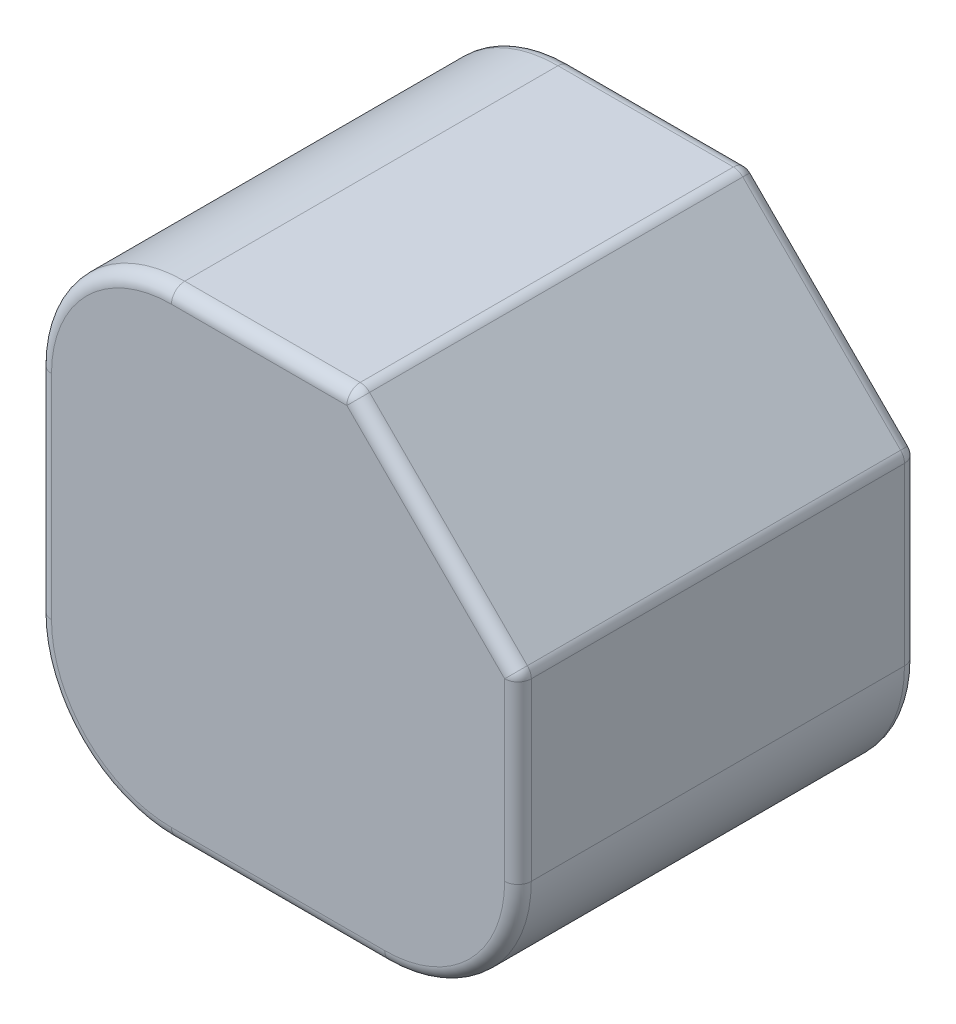
from build123d import *

# Parameters (mm, degrees)
SKETCH1_W                 = 36
SKETCH1_H                 = 36
BOSS_EXTRUDE1_DEPTH       = 15
SKETCH2_R                 = 10
CUT_EXTRUDE1_DEPTH        = 4
SKETCH4_R                 = 10
CUT_EXTRUDE2_DEPTH        = 4
M8X1_0_TAPPED_HOLE1_D     = 7
M8X1_0_TAPPED_HOLE1_DEPTH = 15
M8X1_0_TAPPED_HOLE1_TIP   = 2.103012167
M8X1_0_TAPPED_HOLE2_D     = 7
M8X1_0_TAPPED_HOLE2_DEPTH = 15
M8X1_0_TAPPED_HOLE2_TIP   = 2.103012167
FILLET1_R                 = 10
M4X0_7_TAPPED_HOLE1_D     = 3.3
M4X0_7_TAPPED_HOLE1_DEPTH = 10.1
M4X0_7_TAPPED_HOLE1_TIP   = 0.991420021
CUT_EXTRUDE3_DEPTH        = 60.093146983
FILLET2_R                 = 1


with BuildPart() as part:
    # Sketch1 → Boss-Extrude1 (new, symmetric)
    with BuildSketch(Plane.XY):
        with Locations((-18, -18)):
            Rectangle(SKETCH1_W, SKETCH1_H)
    extrude(amount=BOSS_EXTRUDE1_DEPTH, both=True)

    # Sketch2 → Cut-Extrude1 (cut)
    with BuildSketch(Plane.XZ.offset(36)):
        with Locations((-19.294, 0)):
            Circle(SKETCH2_R)
    extrude(amount=-CUT_EXTRUDE1_DEPTH, mode=Mode.SUBTRACT)

    # Sketch4 → Cut-Extrude2 (cut)
    with BuildSketch(Plane.ZY.offset(36)):
        with Locations(Location((0, -19.294, 0), (0, 0, 270))):
            Circle(SKETCH4_R)
    extrude(amount=-CUT_EXTRUDE2_DEPTH, mode=Mode.SUBTRACT)

    # M8x1.0 Tapped Hole1
    with Locations(Plane.ZY.offset(32)):
        with Locations((0, -19.294)):
            Hole(M8X1_0_TAPPED_HOLE1_D / 2, depth=M8X1_0_TAPPED_HOLE1_DEPTH)
            with Locations((0, 0, -(M8X1_0_TAPPED_HOLE1_DEPTH + M8X1_0_TAPPED_HOLE1_TIP / 2))):  # 118° drill point
                Cone(0, M8X1_0_TAPPED_HOLE1_D / 2, M8X1_0_TAPPED_HOLE1_TIP, mode=Mode.SUBTRACT)

    # M8x1.0 Tapped Hole2
    with Locations(Plane.XZ.offset(32)):
        with Locations((-19.294, 0)):
            Hole(M8X1_0_TAPPED_HOLE2_D / 2, depth=M8X1_0_TAPPED_HOLE2_DEPTH)
            with Locations((0, 0, -(M8X1_0_TAPPED_HOLE2_DEPTH + M8X1_0_TAPPED_HOLE2_TIP / 2))):  # 118° drill point
                Cone(0, M8X1_0_TAPPED_HOLE2_D / 2, M8X1_0_TAPPED_HOLE2_TIP, mode=Mode.SUBTRACT)

    # Fillet1
    # the kernel refuses this fillet: 10 mm, written as the material it takes off along each edge
    with BuildSketch(Plane(origin=(0, -36, 40), x_dir=(0, 1, 0), z_dir=(0, 0, -1)), Plane(origin=(-36, 0, -40), x_dir=(1, 0, 0), z_dir=(0, 0, 1))) as fillet1_piece_1:
        with BuildLine():
            CenterArc((FILLET1_R, -FILLET1_R), FILLET1_R, 90, 90)
            Line((0, -FILLET1_R), (0, 0))
            Line((0, 0), (FILLET1_R, 0))
        make_face()
    extrude(amount=80, mode=Mode.SUBTRACT)
    with BuildSketch(Plane(origin=(-36, -36, -40), x_dir=(1, 0, 0), z_dir=(0, 0, 1))) as fillet1_piece_2:
        with BuildLine():
            CenterArc((FILLET1_R, FILLET1_R), FILLET1_R, 180, 90)
            Line((0, FILLET1_R), (0, 0))
            Line((0, 0), (FILLET1_R, 0))
        make_face()
    extrude(amount=80, mode=Mode.SUBTRACT)

    # M4x0.7 Tapped Hole1
    with Locations(Plane(origin=(0, 0, -15), x_dir=(-1, 0, 0), z_dir=(0, 0, -1))):
        with Locations((29.900601718, -29.900601718), (4.805112606, -23.176285677), (23.176285677, -4.805112606)):
            Hole(M4X0_7_TAPPED_HOLE1_D / 2, depth=M4X0_7_TAPPED_HOLE1_DEPTH)
            with Locations((0, 0, -(M4X0_7_TAPPED_HOLE1_DEPTH + M4X0_7_TAPPED_HOLE1_TIP / 2))):  # 118° drill point
                Cone(0, M4X0_7_TAPPED_HOLE1_D / 2, M4X0_7_TAPPED_HOLE1_TIP, mode=Mode.SUBTRACT)

    # Sketch12 → Cut-Extrude3 (cut, through all)
    with BuildSketch(Plane(origin=(0, 0, -15), x_dir=(-1, 0, 0), z_dir=(0, 0, -1))):
        Polygon((0, -12.425049096), (12.425049096, 0), (0, 0), align=None)
    extrude(amount=-CUT_EXTRUDE3_DEPTH, mode=Mode.SUBTRACT)

    # Fillet2
    fillet2_edges = [part.edges().sort_by_distance(p)[0] for p in [
        (0, -12.425049096, 0),
        (-6.212524548, -6.212524548, 15),
        (-12.425049096, 0, 0),
        (-6.212524548, -6.212524548, -15),
        (-36, -18, -15),
        (-36, -18, 15),
        (0, -19.212524548, -15),
        (-18, -36, -15),
        (-33.071067812, -33.071067812, -15),
        (-2.928932188, -33.071067812, -15),
        (-33.071067812, -2.928932188, -15),
        (0, -19.212524548, 15),
        (-18, -36, 15),
        (-33.071067812, -33.071067812, 15),
        (-2.928932188, -33.071067812, 15),
        (-33.071067812, -2.928932188, 15),
        (-19.212524548, 0, -15),
        (-19.212524548, 0, 15),
    ]]
    fillet(fillet2_edges, radius=FILLET2_R)


solid = part.part
